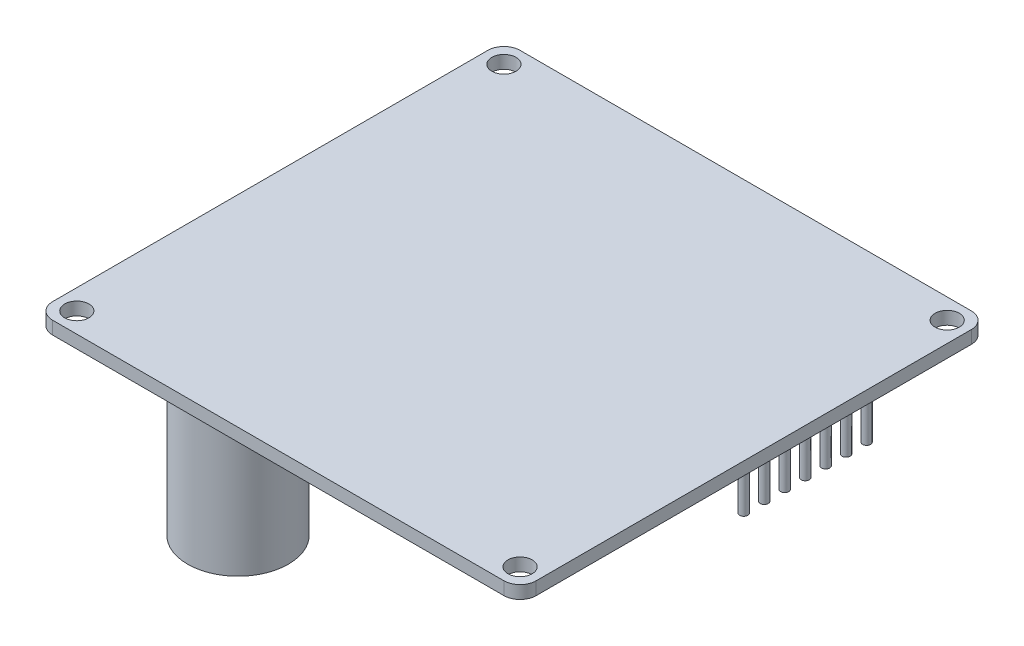
from build123d import *

# Parameters (mm, degrees)
SKETCH1_W             = 60
SKETCH1_H             = 58
BOSS_EXTRUDE1_DEPTH   = 1.6
FILLET1_R             = 2
SKETCH2_R             = 1.5
CUT_EXTRUDE1_DEPTH    = 1.6
SKETCH3_R             = 6.25
BOSS_EXTRUDE2_DEPTH   = 20
SKETCH4_W             = 5
SKETCH4_H             = 30
BOSS_EXTRUDE3_DEPTH   = 10
SKETCH5_W             = 2.54
SKETCH5_H             = 2.54
BOSS_EXTRUDE4_DEPTH   = 2
FILLET2_R             = 0.5
SKETCH6_R             = 0.5
BOSS_EXTRUDE5_DEPTH   = 7
LPATTERN1_START       = -2
LPATTERN1_DEPTH       = 2
LPATTERN1_START_2     = -9
LPATTERN1_2_OUTLINE_R = 0.5
LPATTERN1_2_DEPTH     = 7


# Read off the part's stored shape, not the designer's step: LPattern1
with BuildPart() as part:
    # Sketch1 → Boss-Extrude1 (new body)
    with BuildSketch(Plane(origin=(0, 0, 0), x_dir=(1, 0, 0), z_dir=(0, 1, 0))):
        Rectangle(SKETCH1_W, SKETCH1_H)
    extrude(amount=BOSS_EXTRUDE1_DEPTH)

    # Fillet1
    fillet1_edges = [part.edges().sort_by_distance(p)[0] for p in [
        (-30, 0.8, -29),
        (30, 0.8, -29),
        (30, 0.8, 29),
        (-30, 0.8, 29),
    ]]
    fillet(fillet1_edges, radius=FILLET1_R)

    # Sketch2 → Cut-Extrude1 (cut)
    with BuildSketch(Plane.XZ):
        with Locations(Location((-27.5, 26.5, 0), (0, 0, 270))):
            Circle(SKETCH2_R)
        with Locations(Location((-27.5, -26.5, 0), (0, 0, 90))):
            Circle(SKETCH2_R)
        with Locations(Location((27.5, -26.5, 0), (0, 0, 270))):
            Circle(SKETCH2_R)
        with Locations(Location((27.5, 26.5, 0), (0, 0, 90))):
            Circle(SKETCH2_R)
    extrude(amount=-CUT_EXTRUDE1_DEPTH, mode=Mode.SUBTRACT)

    # Sketch3 → Boss-Extrude2 (add)
    with BuildSketch(Plane.XZ):
        with Locations(Location((-15, 19, 0), (0, 0, 90))):
            Circle(SKETCH3_R)
    extrude(amount=BOSS_EXTRUDE2_DEPTH)

    # Sketch4 → Boss-Extrude3 (add)
    with BuildSketch(Plane.XZ):
        with Locations((-24, -1)):
            Rectangle(SKETCH4_W, SKETCH4_H)
    extrude(amount=BOSS_EXTRUDE3_DEPTH)

    # Sketch5 → Boss-Extrude4 (add)
    with BuildSketch(Plane.XZ):
        with Locations((25, -19)):
            Rectangle(SKETCH5_W, SKETCH5_H)
    extrude(amount=BOSS_EXTRUDE4_DEPTH)

    # Fillet2
    fillet2_edges = [part.edges().sort_by_distance(p)[0] for p in [
        (26.27, -1, -20.27),
        (26.27, -1, -17.73),
        (23.73, -1, -17.73),
        (23.73, -1, -20.27),
    ]]
    fillet(fillet2_edges, radius=FILLET2_R)

    # Sketch6 → Boss-Extrude5 (add)
    with BuildSketch(Plane.XZ.offset(2)):
        with Locations(Location((25, -19, 0), (0, 0, 90))):
            Circle(SKETCH6_R)
    extrude(amount=BOSS_EXTRUDE5_DEPTH)

    # LPattern1 outline → LPattern1 (add)
    with BuildSketch(Plane(origin=(0, 0, 0), x_dir=(1, 0, 0), z_dir=(0, 1, 0)).offset(LPATTERN1_START)):
        with BuildLine():
            Line((26.27, 15.69), (26.27, 17.23))
            ThreePointArc((26.27, 17.23), (26.123553391, 17.583553391), (25.77, 17.73))
            Line((25.77, 17.73), (24.23, 17.73))
            ThreePointArc((24.23, 17.73), (23.876446609, 17.583553391), (23.73, 17.23))
            Line((23.73, 17.23), (23.73, 15.69))
            ThreePointArc((23.73, 15.69), (23.876446609, 15.336446609), (24.23, 15.19))
            ThreePointArc((24.23, 15.19), (23.876446609, 15.043553391), (23.73, 14.69))
            Line((23.73, 14.69), (23.73, 13.15))
            ThreePointArc((23.73, 13.15), (23.876446609, 12.796446609), (24.23, 12.65))
            ThreePointArc((24.23, 12.65), (23.876446609, 12.503553391), (23.73, 12.15))
            Line((23.73, 12.15), (23.73, 10.61))
            ThreePointArc((23.73, 10.61), (23.876446609, 10.256446609), (24.23, 10.11))
            ThreePointArc((24.23, 10.11), (23.876446609, 9.963553391), (23.73, 9.61))
            Line((23.73, 9.61), (23.73, 8.07))
            ThreePointArc((23.73, 8.07), (23.876446609, 7.716446609), (24.23, 7.57))
            ThreePointArc((24.23, 7.57), (23.876446609, 7.423553391), (23.73, 7.07))
            Line((23.73, 7.07), (23.73, 5.53))
            ThreePointArc((23.73, 5.53), (23.876446609, 5.176446609), (24.23, 5.03))
            ThreePointArc((24.23, 5.03), (23.876446609, 4.883553391), (23.73, 4.53))
            Line((23.73, 4.53), (23.73, 2.99))
            ThreePointArc((23.73, 2.99), (23.876446609, 2.636446609), (24.23, 2.49))
            Line((24.23, 2.49), (25.77, 2.49))
            ThreePointArc((25.77, 2.49), (26.123553391, 2.636446609), (26.27, 2.99))
            Line((26.27, 2.99), (26.27, 4.53))
            ThreePointArc((26.27, 4.53), (26.123553391, 4.883553391), (25.77, 5.03))
            ThreePointArc((25.77, 5.03), (26.123553391, 5.176446609), (26.27, 5.53))
            Line((26.27, 5.53), (26.27, 7.07))
            ThreePointArc((26.27, 7.07), (26.123553391, 7.423553391), (25.77, 7.57))
            ThreePointArc((25.77, 7.57), (26.123553391, 7.716446609), (26.27, 8.07))
            Line((26.27, 8.07), (26.27, 9.61))
            ThreePointArc((26.27, 9.61), (26.123553391, 9.963553391), (25.77, 10.11))
            ThreePointArc((25.77, 10.11), (26.123553391, 10.256446609), (26.27, 10.61))
            Line((26.27, 10.61), (26.27, 12.15))
            ThreePointArc((26.27, 12.15), (26.123553391, 12.503553391), (25.77, 12.65))
            ThreePointArc((25.77, 12.65), (26.123553391, 12.796446609), (26.27, 13.15))
            Line((26.27, 13.15), (26.27, 14.69))
            ThreePointArc((26.27, 14.69), (26.123553391, 15.043553391), (25.77, 15.19))
            ThreePointArc((25.77, 15.19), (26.123553391, 15.336446609), (26.27, 15.69))
        make_face()
    extrude(amount=LPATTERN1_DEPTH)

    # LPattern1 2 outline → LPattern1 2 (add)
    with BuildSketch(Plane(origin=(0, 0, 0), x_dir=(1, 0, 0), z_dir=(0, 1, 0)).offset(LPATTERN1_START_2)):
        with Locations((25, 16.46)):
            Circle(LPATTERN1_2_OUTLINE_R)
        with Locations((25, 13.92)):
            Circle(LPATTERN1_2_OUTLINE_R)
        with Locations((25, 11.38)):
            Circle(LPATTERN1_2_OUTLINE_R)
        with Locations((25, 8.84)):
            Circle(LPATTERN1_2_OUTLINE_R)
        with Locations((25, 6.3)):
            Circle(LPATTERN1_2_OUTLINE_R)
        with Locations((25, 3.76)):
            Circle(LPATTERN1_2_OUTLINE_R)
    extrude(amount=LPATTERN1_2_DEPTH)


solid = part.part
